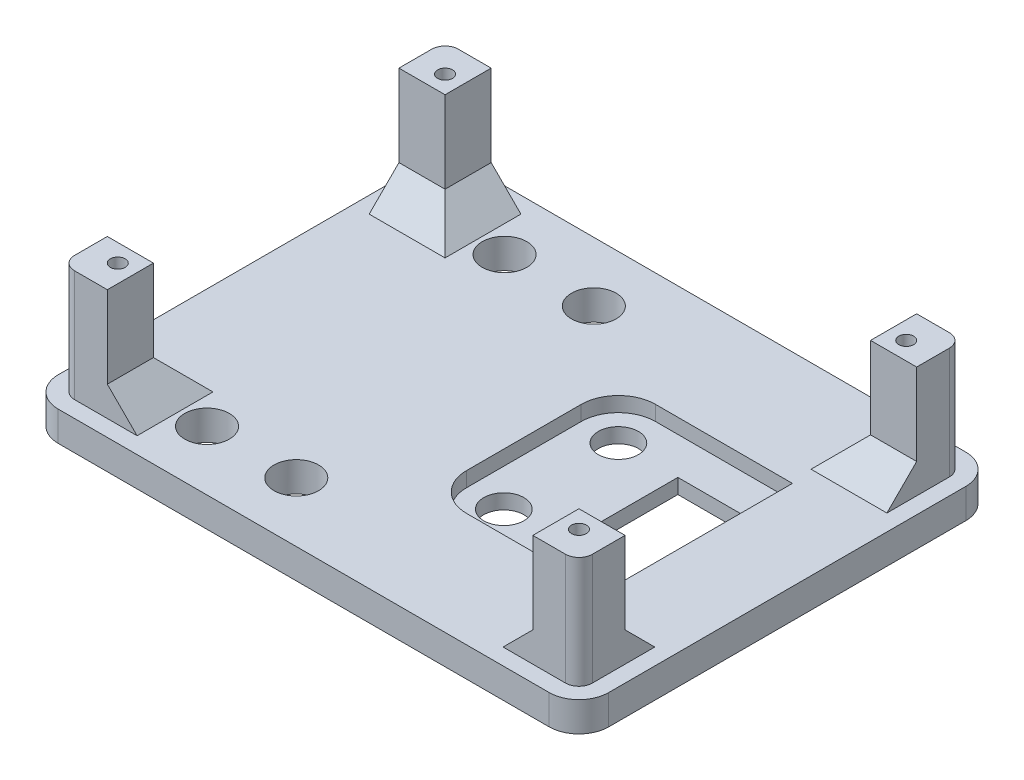
from build123d import *

# Parameters (mm, degrees)
SKETCH1_W           = 93.98
SKETCH1_H           = 71.12
BOSS_EXTRUDE1_DEPTH = 5.08
FILLET4_R           = 5.08
CUT_EXTRUDE5_REACH  = 119.967
SKETCH7_R           = 3.429
SKETCH7_W           = 13.208
SKETCH7_H           = 19.558
CUT_EXTRUDE7_DEPTH  = 2.54
CUT_EXTRUDE8_REACH  = 119.967
SKETCH8_R           = 3.81
SKETCH2_W           = 7.874
SKETCH2_H           = 7.874
BOSS_EXTRUDE3_DEPTH = 30.48
SKETCH10_R          = 1.27
CUT_EXTRUDE9_DEPTH  = 12.7
FILLET5_R           = 2.286
CHAMFER4_SIZE       = 5.08
SKETCH11_W          = 103.535361548
SKETCH11_H          = 78.086950251
CUT_EXTRUDE10_DEPTH = 2.54
SKETCH12_W          = 126.754713741
SKETCH12_H          = 92.713600662
CUT_EXTRUDE11_DEPTH = 8.89
SKETCH13_R          = 1.27
CUT_EXTRUDE12_DEPTH = 19.05


with BuildPart() as part:
    # Sketch1 → Boss-Extrude1 (new body)
    with BuildSketch(Plane(origin=(0, 0, 0), x_dir=(1, 0, 0), z_dir=(0, 1, 0))):
        with Locations((46.99, 35.56)):
            Rectangle(SKETCH1_W, SKETCH1_H)
    extrude(amount=BOSS_EXTRUDE1_DEPTH)

    # Fillet4
    fillet4_edges = [part.edges().sort_by_distance(p)[0] for p in [
        (0, 2.54, -71.12),
        (93.98, 2.54, -71.12),
        (93.98, 2.54, 0),
        (0, 2.54, 0),
    ]]
    fillet(fillet4_edges, radius=FILLET4_R)

    # Sketch7 → Cut-Extrude5 (cut, up to next)
    with BuildSketch(Plane(origin=(0, 5.08, 0), x_dir=(1, 0, 0), z_dir=(0, 1, 0)), mode=Mode.PRIVATE) as cut_extrude5_sk1:
        with Locations((55.372, 45.339)):
            Circle(SKETCH7_R)
    cut_extrude5_tool1 = extrude(cut_extrude5_sk1.sketch, amount=-CUT_EXTRUDE5_REACH, mode=Mode.PRIVATE) & part.part
    # Sketch7 → Cut-Extrude5 (cut, up to next)
    with BuildSketch(Plane(origin=(0, 5.08, 0), x_dir=(1, 0, 0), z_dir=(0, 1, 0)), mode=Mode.PRIVATE) as cut_extrude5_sk2:
        with Locations((55.372, 25.781)):
            Circle(SKETCH7_R)
    cut_extrude5_tool2 = extrude(cut_extrude5_sk2.sketch, amount=-CUT_EXTRUDE5_REACH, mode=Mode.PRIVATE) & part.part
    # Sketch7 → Cut-Extrude5 (cut, up to next)
    with BuildSketch(Plane(origin=(0, 5.08, 0), x_dir=(1, 0, 0), z_dir=(0, 1, 0)), mode=Mode.PRIVATE) as cut_extrude5_sk3:
        with Locations((72.136, 35.56)):
            Rectangle(SKETCH7_W, SKETCH7_H)
    cut_extrude5_tool3 = extrude(cut_extrude5_sk3.sketch, amount=-CUT_EXTRUDE5_REACH, mode=Mode.PRIVATE) & part.part
    add(cut_extrude5_tool1.solids().sort_by_distance((55.372, 5.08, -45.339))[0], mode=Mode.SUBTRACT)
    add(cut_extrude5_tool2.solids().sort_by_distance((55.372, 5.08, -25.781))[0], mode=Mode.SUBTRACT)
    add(cut_extrude5_tool3.solids().sort_by_distance((72.136, 5.08, -35.56))[0], mode=Mode.SUBTRACT)

    # Sketch9 → Cut-Extrude7 (cut)
    with BuildSketch(Plane(origin=(0, 5.08, 0), x_dir=(1, 0, 0), z_dir=(0, 1, 0))):
        with BuildLine():
            Line((49.022, 45.339), (49.022, 25.781))
            ThreePointArc((49.022, 25.781), (50.881871939, 21.290871939), (55.372, 19.431))
            Line((55.372, 19.431), (65.532, 19.431))
            Line((65.532, 19.431), (78.74, 19.431))
            Line((78.74, 19.431), (78.74, 51.689))
            Line((78.74, 51.689), (65.532, 51.689))
            Line((65.532, 51.689), (55.372, 51.689))
            ThreePointArc((55.372, 51.689), (50.881871939, 49.829128061), (49.022, 45.339))
        make_face()
    extrude(amount=-CUT_EXTRUDE7_DEPTH, mode=Mode.SUBTRACT)

    # Sketch8 → Cut-Extrude8 (cut, up to next)
    with BuildSketch(Plane(origin=(0, 5.08, 0), x_dir=(1, 0, 0), z_dir=(0, 1, 0)), mode=Mode.PRIVATE) as cut_extrude8_sk1:
        with Locations((20.32, 10.16)):
            Circle(SKETCH8_R)
    cut_extrude8_tool1 = extrude(cut_extrude8_sk1.sketch, amount=-CUT_EXTRUDE8_REACH, mode=Mode.PRIVATE) & part.part
    # Sketch8 → Cut-Extrude8 (cut, up to next)
    with BuildSketch(Plane(origin=(0, 5.08, 0), x_dir=(1, 0, 0), z_dir=(0, 1, 0)), mode=Mode.PRIVATE) as cut_extrude8_sk2:
        with Locations((35.56, 10.16)):
            Circle(SKETCH8_R)
    cut_extrude8_tool2 = extrude(cut_extrude8_sk2.sketch, amount=-CUT_EXTRUDE8_REACH, mode=Mode.PRIVATE) & part.part
    # Sketch8 → Cut-Extrude8 (cut, up to next)
    with BuildSketch(Plane(origin=(0, 5.08, 0), x_dir=(1, 0, 0), z_dir=(0, 1, 0)), mode=Mode.PRIVATE) as cut_extrude8_sk3:
        with Locations((35.56, 60.96)):
            Circle(SKETCH8_R)
    cut_extrude8_tool3 = extrude(cut_extrude8_sk3.sketch, amount=-CUT_EXTRUDE8_REACH, mode=Mode.PRIVATE) & part.part
    # Sketch8 → Cut-Extrude8 (cut, up to next)
    with BuildSketch(Plane(origin=(0, 5.08, 0), x_dir=(1, 0, 0), z_dir=(0, 1, 0)), mode=Mode.PRIVATE) as cut_extrude8_sk4:
        with Locations((20.32, 60.96)):
            Circle(SKETCH8_R)
    cut_extrude8_tool4 = extrude(cut_extrude8_sk4.sketch, amount=-CUT_EXTRUDE8_REACH, mode=Mode.PRIVATE) & part.part
    add(cut_extrude8_tool1.solids().sort_by_distance((20.32, 5.08, -10.16))[0], mode=Mode.SUBTRACT)
    add(cut_extrude8_tool2.solids().sort_by_distance((35.56, 5.08, -10.16))[0], mode=Mode.SUBTRACT)
    add(cut_extrude8_tool3.solids().sort_by_distance((35.56, 5.08, -60.96))[0], mode=Mode.SUBTRACT)
    add(cut_extrude8_tool4.solids().sort_by_distance((20.32, 5.08, -60.96))[0], mode=Mode.SUBTRACT)

    # Sketch2 → Boss-Extrude3 (add)
    with BuildSketch(Plane(origin=(0, 5.08, 0), x_dir=(1, 0, 0), z_dir=(0, 1, 0))):
        with Locations((6.731, 64.389)):
            Rectangle(SKETCH2_W, SKETCH2_H)
        with Locations((87.249, 64.389)):
            Rectangle(SKETCH2_W, SKETCH2_H)
        with Locations((87.249, 6.731)):
            Rectangle(SKETCH2_W, SKETCH2_H)
        with Locations((6.731, 6.731)):
            Rectangle(SKETCH2_W, SKETCH2_H)
    extrude(amount=BOSS_EXTRUDE3_DEPTH)

    # Sketch10 → Cut-Extrude9 (cut)
    with BuildSketch(Plane(origin=(0, 35.56, 0), x_dir=(1, 0, 0), z_dir=(0, 1, 0))):
        with Locations((7.62, 63.5)):
            Circle(SKETCH10_R)
        with Locations((86.36, 63.5)):
            Circle(SKETCH10_R)
        with Locations((86.36, 7.62)):
            Circle(SKETCH10_R)
        with Locations((7.62, 7.62)):
            Circle(SKETCH10_R)
    extrude(amount=-CUT_EXTRUDE9_DEPTH, mode=Mode.SUBTRACT)

    # Fillet5
    fillet5_edges = [part.edges().sort_by_distance(p)[0] for p in [
        (91.186, 20.32, -68.326),
        (91.186, 20.32, -2.794),
        (2.794, 20.32, -2.794),
        (2.794, 20.32, -68.326),
    ]]
    fillet(fillet5_edges, radius=FILLET5_R)

    # Chamfer4
    chamfer4_edges = [part.edges().sort_by_distance(p)[0] for p in [
        (87.249, 5.08, -10.668),
        (83.312, 5.08, -6.731),
        (87.249, 5.08, -60.452),
        (83.312, 5.08, -64.389),
        (10.668, 5.08, -6.731),
        (6.731, 5.08, -10.668),
        (10.668, 5.08, -64.389),
        (6.731, 5.08, -60.452),
    ]]
    chamfer(chamfer4_edges, length=CHAMFER4_SIZE)

    # Sketch11 → Cut-Extrude10 (cut)
    with BuildSketch(Plane(origin=(0, 35.56, 0), x_dir=(1, 0, 0), z_dir=(0, 1, 0))):
        with Locations((47.570572121, 35.36647596)):
            Rectangle(SKETCH11_W, SKETCH11_H)
    extrude(amount=-CUT_EXTRUDE10_DEPTH, mode=Mode.SUBTRACT)

    # Sketch12 → Cut-Extrude11 (cut)
    with BuildSketch(Plane(origin=(0, 33.02, 0), x_dir=(1, 0, 0), z_dir=(0, 1, 0))):
        with Locations((42.146253046, 37.500061566)):
            Rectangle(SKETCH12_W, SKETCH12_H)
    extrude(amount=-CUT_EXTRUDE11_DEPTH, mode=Mode.SUBTRACT)

    # Sketch13 → Cut-Extrude12 (cut)
    with BuildSketch(Plane(origin=(0, 24.13, 0), x_dir=(1, 0, 0), z_dir=(0, 1, 0))):
        with Locations((86.36, 7.62)):
            Circle(SKETCH13_R)
        with Locations((7.62, 7.62)):
            Circle(SKETCH13_R)
        with Locations((86.36, 63.5)):
            Circle(SKETCH13_R)
        with Locations((7.62, 63.5)):
            Circle(SKETCH13_R)
    extrude(amount=-CUT_EXTRUDE12_DEPTH, mode=Mode.SUBTRACT)


solid = part.part
